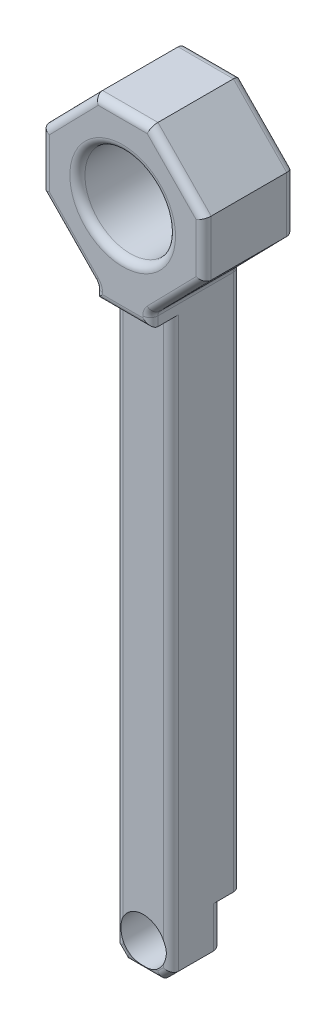
from build123d import *

# Parameters (mm, degrees)
SKETCH1_R               = 9
SKETCH1_R_2             = 4.5
BOSS_EXTRUDE1_DEPTH     = 18
CUT_EXTRUDE1_DEPTH      = 86.684353416
CUT_EXTRUDE1_DEPTH_BACK = 86.684353416
FILLET1_R               = 1.5


with BuildPart() as part:
    # Sketch1 → Boss-Extrude1 (new body)
    with BuildSketch(Plane.XY):
        Polygon((-7.557553962, -67.195132078), (-7.557553962, 48.266235791), (-18.143619364, 59.093986602), (-18.143619364, 70.115749241), (-7.557553962, 80.943500052), (3.442446038, 80.943500052), (14.02851144, 70.115749241), (14.02851144, 59.093986602), (3.442446038, 48.266235791), (3.442446038, -67.195132078), (1.442446038, -69.195132078), (-5.557553962, -69.195132078), align=None)
        with Locations((-2.057553962, 64.604867922)):
            Circle(SKETCH1_R, mode=Mode.SUBTRACT)
        with Locations((-2.057553962, -63.895132078)):
            Circle(SKETCH1_R_2, mode=Mode.SUBTRACT)
    extrude(amount=BOSS_EXTRUDE1_DEPTH)

    # Sketch2 → Cut-Extrude1 (cut, two sides: drawn at the far end of the back side and taken through both)
    with BuildSketch(Plane.ZY.offset(7.557553962).offset(-CUT_EXTRUDE1_DEPTH_BACK)):
        Polygon((3.920552613, -84.398483755), (3.920552613, -59.021038695), (-18.582585697, -59.021038695), (-18.582585697, -119.504750135), (35.581125662, -119.504750135), (35.581125662, 45.802779434), (13.920552613, 45.802779434), (13.920552613, -84.398483755), align=None)
    extrude(amount=CUT_EXTRUDE1_DEPTH + CUT_EXTRUDE1_DEPTH_BACK, mode=Mode.SUBTRACT)

    # Fillet1
    # the kernel refuses this fillet: 1.5 mm, written as the material it adds along each edge
    with BuildSketch(Plane(origin=(3.442446038, 48.266235791, 0), x_dir=(0, -1, 0), z_dir=(0, 0, 1))) as fillet1_piece_1:
        with BuildLine():
            CenterArc((FILLET1_R * 0.407617755976, FILLET1_R), FILLET1_R, 225.646637005, 44.353362995)
            Line((-FILLET1_R * 0.291463794008, FILLET1_R * 0.284958052649), (0, 0))
            Line((0, 0), (FILLET1_R * 0.407617755976, 0))
        make_face()
    extrude(amount=18)
    with BuildSketch(Plane(origin=(-7.557553962, 48.266235791, 0), x_dir=(0, -1, 0), z_dir=(0, 0, 1))) as fillet1_piece_2:
        with BuildLine():
            CenterArc((FILLET1_R * 0.407617755976, -FILLET1_R), FILLET1_R, 90, 44.353362995)
            Line((-FILLET1_R * 0.291463794008, -FILLET1_R * 0.284958052649), (0, 0))
            Line((0, 0), (FILLET1_R * 0.407617755976, 0))
        make_face()
    extrude(amount=18)
    # the kernel refuses this fillet: 1.5 mm, written as the material it takes off along each edge
    with BuildSketch(Plane(origin=(-18.143619364, 55.343986602, 0), x_dir=(1, 0, 0), z_dir=(0, 1, 0)), Plane(origin=(14.02851144, 73.865749241, 0), x_dir=(-1, 0, 0), z_dir=(0, -1, 0))) as fillet1_2_piece_1:
        with BuildLine():
            CenterArc((FILLET1_R, -FILLET1_R), FILLET1_R, 90, 90)
            Line((0, -FILLET1_R), (0, 0))
            Line((0, 0), (FILLET1_R, 0))
        make_face()
    extrude(amount=18.521762639, mode=Mode.SUBTRACT)
    with BuildSketch(Plane(origin=(-20.765175176, 67.434341939, 0), x_dir=(0.7150419473513874, -0.6990815499839313, 0), z_dir=(0.6990815499839312, 0.7150419473513874, 0)), Plane(origin=(0.820890226, 83.624907355, 0), x_dir=(-0.7150419473513874, -0.6990815499839313, 0), z_dir=(0.6990815499839312, -0.7150419473513874, 0))) as fillet1_2_piece_2:
        with BuildLine():
            CenterArc((FILLET1_R, -FILLET1_R), FILLET1_R, 90, 90)
            Line((0, -FILLET1_R), (0, 0))
            Line((0, 0), (FILLET1_R, 0))
        make_face()
    extrude(amount=22.642819035, mode=Mode.SUBTRACT)
    with BuildSketch(Plane(origin=(-11.307553962, 80.943500052, 0), x_dir=(0, -1, 0), z_dir=(1, 0, 0))) as fillet1_2_piece_3:
        with BuildLine():
            CenterArc((FILLET1_R, -FILLET1_R), FILLET1_R, 90, 90)
            Line((0, -FILLET1_R), (0, 0))
            Line((0, 0), (FILLET1_R, 0))
        make_face()
    extrude(amount=18.5, mode=Mode.SUBTRACT)
    with BuildSketch(Plane(origin=(16.650067253, 61.775393905, 0), x_dir=(-0.7150419473513876, 0.699081549983931, 0), z_dir=(-0.699081549983931, -0.7150419473513876, 0)), Plane(origin=(-7.984991041, 48.703431482, 0), x_dir=(0.7150419473513876, 0.699081549983931, 0), z_dir=(-0.699081549983931, 0.7150419473513876, 0))) as fillet1_2_piece_4:
        with BuildLine():
            CenterArc((FILLET1_R, -FILLET1_R), FILLET1_R, 90, 90)
            Line((0, -FILLET1_R), (0, 0))
            Line((0, 0), (FILLET1_R, 0))
        make_face()
    extrude(amount=18.281392401, mode=Mode.SUBTRACT)
    with BuildSketch(Plane(origin=(-7.557553962, -62.771038695, 0), x_dir=(0, 0, 1), z_dir=(0, 1, 0))) as fillet1_2_piece_5:
        with BuildLine():
            CenterArc((FILLET1_R, FILLET1_R), FILLET1_R, 180, 90)
            Line((0, FILLET1_R), (0, 0))
            Line((0, 0), (FILLET1_R, 0))
        make_face()
    extrude(amount=110.425847852, mode=Mode.SUBTRACT)
    with BuildSketch(Plane(origin=(16.650067253, 61.775393905, 18), x_dir=(-0.7150419473513876, 0.699081549983931, 0), z_dir=(-0.699081549983931, -0.7150419473513876, 0)), Plane(origin=(-7.984991041, 48.703431482, 18), x_dir=(0.7150419473513876, 0.699081549983931, 0), z_dir=(-0.699081549983931, 0.7150419473513876, 0))) as fillet1_2_piece_6:
        with BuildLine():
            CenterArc((FILLET1_R, FILLET1_R), FILLET1_R, 180, 90)
            Line((0, FILLET1_R), (0, 0))
            Line((0, 0), (FILLET1_R, 0))
        make_face()
    extrude(amount=18.281392401, mode=Mode.SUBTRACT)
    with BuildSketch(Plane(origin=(-2.057553962, 64.604867922, 18), x_dir=(1, 0, 0), z_dir=(0, -1, 0))) as fillet1_2_piece_7:
        with BuildLine():
            CenterArc((9 + FILLET1_R, -FILLET1_R), FILLET1_R, 90, 90)
            Line((9, -FILLET1_R), (9, 0))
            Line((9, 0), (9 + FILLET1_R, 0))
        make_face()
    revolve(axis=Axis((-2.057553962, 64.604867922, 18), (0, 0, 1)), mode=Mode.SUBTRACT)
    with BuildSketch(Plane(origin=(14.02851144, 73.865749241, 18), x_dir=(-1, 0, 0), z_dir=(0, -1, 0)), Plane(origin=(-18.143619364, 55.343986602, 18), x_dir=(1, 0, 0), z_dir=(0, 1, 0))) as fillet1_2_piece_8:
        with BuildLine():
            CenterArc((FILLET1_R, FILLET1_R), FILLET1_R, 180, 90)
            Line((0, FILLET1_R), (0, 0))
            Line((0, 0), (FILLET1_R, 0))
        make_face()
    extrude(amount=18.521762639, mode=Mode.SUBTRACT)
    with BuildSketch(Plane(origin=(0.820890226, 83.624907355, 18), x_dir=(-0.7150419473513874, -0.6990815499839313, 0), z_dir=(0.6990815499839312, -0.7150419473513874, 0)), Plane(origin=(-20.765175176, 67.434341939, 18), x_dir=(0.7150419473513874, -0.6990815499839313, 0), z_dir=(0.6990815499839312, 0.7150419473513874, 0))) as fillet1_2_piece_9:
        with BuildLine():
            CenterArc((FILLET1_R, FILLET1_R), FILLET1_R, 180, 90)
            Line((0, FILLET1_R), (0, 0))
            Line((0, 0), (FILLET1_R, 0))
        make_face()
    extrude(amount=22.642819035, mode=Mode.SUBTRACT)
    with BuildSketch(Plane(origin=(-11.307553962, 80.943500052, 18), x_dir=(0, -1, 0), z_dir=(1, 0, 0)), Plane(origin=(7.192446038, 45.802779434, 18), x_dir=(0, 1, 0), z_dir=(-1, 0, 0))) as fillet1_2_piece_10:
        with BuildLine():
            CenterArc((FILLET1_R, FILLET1_R), FILLET1_R, 180, 90)
            Line((0, FILLET1_R), (0, 0))
            Line((0, 0), (FILLET1_R, 0))
        make_face()
    extrude(amount=18.5, mode=Mode.SUBTRACT)
    with BuildSketch(Plane(origin=(3.442446038, 47.654809157, 0), x_dir=(-1, 0, 0), z_dir=(0, -1, 0))) as fillet1_2_piece_11:
        with BuildLine():
            CenterArc((FILLET1_R, -FILLET1_R), FILLET1_R, 90, 90)
            Line((0, -FILLET1_R), (0, 0))
            Line((0, 0), (FILLET1_R, 0))
        make_face()
    extrude(amount=110.425847852, mode=Mode.SUBTRACT)
    with BuildSketch(Plane(origin=(3.442446038, 47.654809157, 18), x_dir=(-1, 0, 0), z_dir=(0, -1, 0))) as fillet1_2_piece_12:
        with BuildLine():
            CenterArc((FILLET1_R, FILLET1_R), FILLET1_R, 180, 90)
            Line((0, FILLET1_R), (0, 0))
            Line((0, 0), (FILLET1_R, 0))
        make_face()
    extrude(amount=5.602029724, mode=Mode.SUBTRACT)
    with BuildSketch(Plane(origin=(-2.905903532, -71.846782508, 13.920552613), x_dir=(0.7071067811865479, 0.707106781186547, 0), z_dir=(-0.7071067811865471, 0.707106781186548, 0)), Plane(origin=(6.094096468, -64.543481649, 13.920552613), x_dir=(-0.7071067811865501, 0.7071067811865448, 0), z_dir=(-0.7071067811865448, -0.7071067811865502, 0)), Plane(origin=(-1.209204391, -71.846782508, 3.920552613), x_dir=(-0.7071067811865502, 0.7071067811865449, 0), z_dir=(0.7071067811865448, 0.7071067811865502, 0))) as fillet1_2_piece_13:
        with BuildLine():
            CenterArc((FILLET1_R, FILLET1_R), FILLET1_R, 180, 90)
            Line((0, FILLET1_R), (0, 0))
            Line((0, 0), (FILLET1_R, 0))
        make_face()
    extrude(amount=10.328427125, mode=Mode.SUBTRACT)
    with BuildSketch(Plane(origin=(-7.557553962, -70.945132078, 13.920552613), x_dir=(0, 0, -1), z_dir=(0, 1, 0))) as fillet1_2_piece_14:
        with BuildLine():
            CenterArc((FILLET1_R, -FILLET1_R), FILLET1_R, 90, 90)
            Line((0, -FILLET1_R), (0, 0))
            Line((0, 0), (FILLET1_R, 0))
        make_face()
    extrude(amount=116.747911512, mode=Mode.SUBTRACT)
    with BuildSketch(Plane(origin=(3.442446038, 45.802779434, 13.920552613), x_dir=(-1, 0, 0), z_dir=(0, -1, 0))) as fillet1_2_piece_15:
        with BuildLine():
            CenterArc((FILLET1_R, FILLET1_R), FILLET1_R, 180, 90)
            Line((0, FILLET1_R), (0, 0))
            Line((0, 0), (FILLET1_R, 0))
        make_face()
    extrude(amount=116.747911512, mode=Mode.SUBTRACT)
    with BuildSketch(Plane(origin=(5.192446038, -69.195132078, 13.920552613), x_dir=(0, 1, 0), z_dir=(-1, 0, 0)), Plane(origin=(-9.307553962, -69.195132078, 3.920552613), x_dir=(0, 1, 0), z_dir=(1, 0, 0))) as fillet1_2_piece_16:
        with BuildLine():
            CenterArc((FILLET1_R, FILLET1_R), FILLET1_R, 180, 90)
            Line((0, FILLET1_R), (0, 0))
            Line((0, 0), (FILLET1_R, 0))
        make_face()
    extrude(amount=14.5, mode=Mode.SUBTRACT)
    with BuildSketch(Plane(origin=(-7.557553962, -59.021038695, 3.920552613), x_dir=(0, 0, 1), z_dir=(0, -1, 0))) as fillet1_2_piece_17:
        with BuildLine():
            CenterArc((FILLET1_R, -FILLET1_R), FILLET1_R, 90, 90)
            Line((0, -FILLET1_R), (0, 0))
            Line((0, 0), (FILLET1_R, 0))
        make_face()
    extrude(amount=11.924093383, mode=Mode.SUBTRACT)
    with BuildSketch(Plane(origin=(-10.209204391, -64.543481649, 3.920552613), x_dir=(0, 0, 1), z_dir=(0.7071067811865471, -0.707106781186548, 0))) as fillet1_2_piece_18:
        with BuildLine():
            CenterArc((FILLET1_R, -FILLET1_R), FILLET1_R, 90, 90)
            Line((0, -FILLET1_R), (0, 0))
            Line((0, 0), (FILLET1_R, 0))
        make_face()
    extrude(amount=10.328427125, mode=Mode.SUBTRACT)
    with BuildSketch(Plane(origin=(3.442446038, -70.945132078, 3.920552613), x_dir=(-1, 0, 0), z_dir=(0, 1, 0))) as fillet1_2_piece_19:
        with BuildLine():
            CenterArc((FILLET1_R, FILLET1_R), FILLET1_R, 180, 90)
            Line((0, FILLET1_R), (0, 0))
            Line((0, 0), (FILLET1_R, 0))
        make_face()
    extrude(amount=11.924093383, mode=Mode.SUBTRACT)
    with BuildSketch(Plane(origin=(-7.557553962, 42.052779434, 18), x_dir=(0, 0, -1), z_dir=(0, 1, 0))) as fillet1_2_piece_20:
        with BuildLine():
            CenterArc((FILLET1_R, -FILLET1_R), FILLET1_R, 90, 90)
            Line((0, -FILLET1_R), (0, 0))
            Line((0, 0), (FILLET1_R, 0))
        make_face()
    extrude(amount=5.602029724, mode=Mode.SUBTRACT)
    with BuildSketch(Plane(origin=(-9.057553962, 47.654809157, 18), x_dir=(1, 0, 0), z_dir=(0, -1, 0))) as fillet1_2_piece_21:
        with BuildLine():
            CenterArc((1.5 + FILLET1_R, -FILLET1_R), FILLET1_R, 90, 90)
            Line((1.5 + FILLET1_R, 0), (1.5, 0))
            Line((1.5, 0), (1.5, -FILLET1_R))
        make_face()
    revolve(axis=Axis((-9.057553962, 47.654809157, 18), (0, 0, 1)), revolution_arc=44.353362995, mode=Mode.SUBTRACT)
    with BuildSketch(Plane(origin=(4.942446038, 47.654809157, 18), x_dir=(-1, 0, 0), z_dir=(0, -1, 0))) as fillet1_2_piece_22:
        with BuildLine():
            CenterArc((1.5 + FILLET1_R, FILLET1_R), FILLET1_R, 180, 90)
            Line((1.5, FILLET1_R), (1.5, 0))
            Line((1.5, 0), (1.5 + FILLET1_R, 0))
        make_face()
    revolve(axis=Axis((4.942446038, 47.654809157, 18), (0, 0, -1)), revolution_arc=44.353362995, mode=Mode.SUBTRACT)
    with BuildSketch(Plane(origin=(4.942446038, 47.654809157, 0), x_dir=(-1, 0, 0), z_dir=(0, -1, 0))) as fillet1_2_piece_23:
        with BuildLine():
            CenterArc((1.5 + FILLET1_R, -FILLET1_R), FILLET1_R, 90, 90)
            Line((1.5, -FILLET1_R), (1.5, 0))
            Line((1.5, 0), (1.5 + FILLET1_R, 0))
        make_face()
    revolve(axis=Axis((4.942446038, 47.654809157, 0), (0, 0, -1)), revolution_arc=44.353362995, mode=Mode.SUBTRACT)
    with BuildSketch(Plane(origin=(-9.057553962, 47.654809157, 0), x_dir=(1, 0, 0), z_dir=(0, -1, 0))) as fillet1_2_piece_24:
        with BuildLine():
            CenterArc((1.5 + FILLET1_R, FILLET1_R), FILLET1_R, 180, 90)
            Line((1.5, FILLET1_R), (1.5, 0))
            Line((1.5, 0), (1.5 + FILLET1_R, 0))
        make_face()
    revolve(axis=Axis((-9.057553962, 47.654809157, 0), (0, 0, 1)), revolution_arc=44.353362995, mode=Mode.SUBTRACT)


solid = part.part
